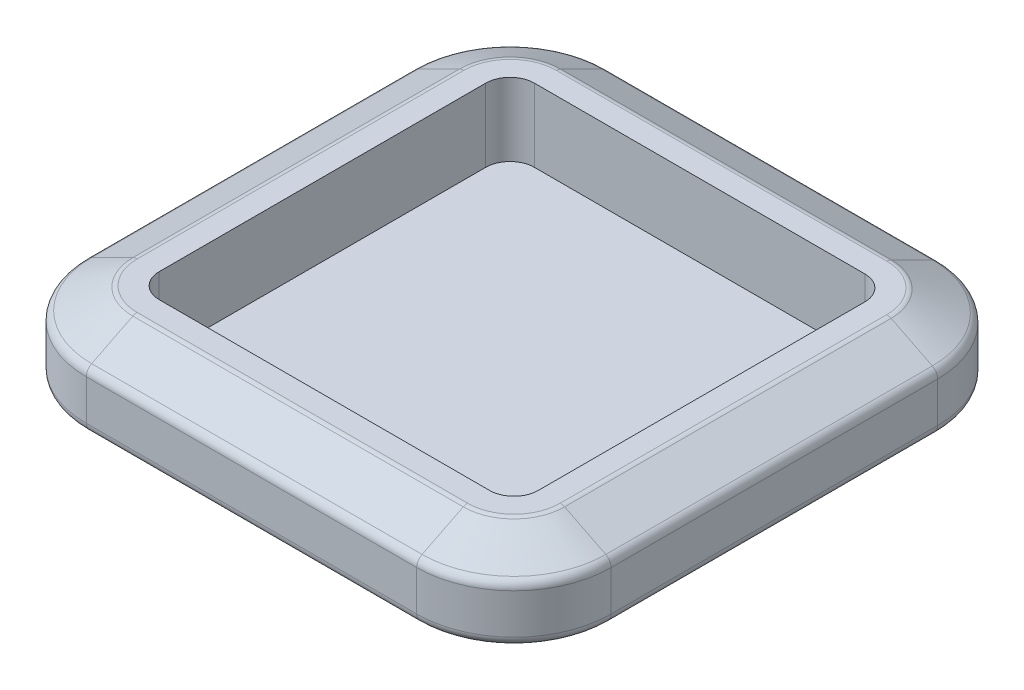
from build123d import *

# Parameters (mm, degrees)
SKETCH5_W           = 107.15
SKETCH5_H           = 18.5
BOSS_EXTRUDE1_DEPTH = 107.94999
SKETCH4_W           = 77.94999
SKETCH4_H           = 77.15084
CUT_EXTRUDE1_DEPTH  = 7.5
FILLET1_R           = 5
FILLET3_R           = 20
CHAMFER1_SIZE       = 10
CHAMFER1_SIZE2      = 5
CUT_EXTRUDE2_DEPTH  = 2
FILLET4_R           = 20
FILLET5_R           = 2
CUT_EXTRUDE3_START  = -7.5
CUT_EXTRUDE3_DEPTH  = 7.5


with BuildPart() as part:
    # Sketch5 → Boss-Extrude1 (new body)
    with BuildSketch(Plane.ZY.offset(-91.769)):
        with Locations((-38.2134, -9.25)):
            Rectangle(SKETCH5_W, SKETCH5_H)
    extrude(amount=BOSS_EXTRUDE1_DEPTH)

    # Sketch4 → Cut-Extrude1 (cut)
    with BuildSketch(Plane(origin=(0, 0, 0), x_dir=(1, 0, 0), z_dir=(0, 1, 0))):
        with Locations((37.794005, 38.21298)):
            Rectangle(SKETCH4_W, SKETCH4_H)
    extrude(amount=-CUT_EXTRUDE1_DEPTH, mode=Mode.SUBTRACT)

    # Fillet1
    fillet1_edges = [part.edges().sort_by_distance(p)[0] for p in [
        (76.769, -3.75, -76.7884),
        (76.769, -3.75, 0.36244),
        (-1.18099, -3.75, 0.36244),
        (-1.18099, -3.75, -76.7884),
    ]]
    fillet(fillet1_edges, radius=FILLET1_R)

    # Fillet3
    fillet3_edges = [part.edges().sort_by_distance(p)[0] for p in [
        (-16.18099, -9.25, -91.7884),
        (-16.18099, -9.25, 15.3616),
        (91.769, -9.25, -91.7884),
        (91.769, -9.25, 15.3616),
    ]]
    fillet(fillet3_edges, radius=FILLET3_R)

    # Chamfer1
    chamfer1_edges = [part.edges().sort_by_distance(p)[0] for p in [
        (37.794005, 0, -91.7884),
        (91.769, 0, -38.2134),
        (-16.18099, 0, -38.2134),
        (37.794005, 0, 15.3616),
        (-10.323125624, 0, -85.930535624),
        (-10.323125624, 0, 9.503735624),
        (85.911135624, 0, 9.503735624),
        (85.911135624, 0, -85.930535624),
    ]]
    chamfer1_side = [part.faces().sort_by_distance(p)[0] for p in [
        (37.794005, 0, 13.840602865),
    ]]
    chamfer(chamfer1_edges, length=CHAMFER1_SIZE, length2=CHAMFER1_SIZE2, reference=chamfer1_side[0])

    # Sketch6 → Cut-Extrude2 (cut)
    with BuildSketch(Plane.XZ.offset(18.5)):
        with BuildLine():
            Line((3.81901, -91.7884), (71.769, -91.7884))
            ThreePointArc((71.769, -91.7884), (85.911135624, -85.930535624), (91.769, -71.7884))
            Line((91.769, -71.7884), (91.769, -4.6384))
            ThreePointArc((91.769, -4.6384), (85.911135624, 9.503735624), (71.769, 15.3616))
            Line((71.769, 15.3616), (3.81901, 15.3616))
            ThreePointArc((3.81901, 15.3616), (-10.323125624, 9.503735624), (-16.18099, -4.6384))
            Line((-16.18099, -4.6384), (-16.18099, -71.7884))
            ThreePointArc((-16.18099, -71.7884), (-10.323125624, -85.930535624), (3.81901, -91.7884))
        make_face()
        with BuildLine():
            Line((3.81901, -79.7884), (71.769, -79.7884))
            ThreePointArc((71.769, -79.7884), (77.425854249, -77.445254249), (79.769, -71.7884))
            Line((79.769, -71.7884), (79.769, -4.6384))
            ThreePointArc((79.769, -4.6384), (77.425854249, 1.018454249), (71.769, 3.3616))
            Line((71.769, 3.3616), (3.81901, 3.3616))
            ThreePointArc((3.81901, 3.3616), (-1.837844249, 1.018454249), (-4.18099, -4.6384))
            Line((-4.18099, -4.6384), (-4.18099, -71.7884))
            ThreePointArc((-4.18099, -71.7884), (-1.837844249, -77.445254249), (3.81901, -79.7884))
        make_face(mode=Mode.SUBTRACT)
    extrude(amount=-CUT_EXTRUDE2_DEPTH, mode=Mode.SUBTRACT)

    # Fillet4
    # the kernel refuses this fillet: 20 mm, written as the material it adds along each edge
    with BuildSketch(Plane(origin=(71.769, -16.5, -4.6384), x_dir=(1, 0, 0), z_dir=(0, 0, -1))) as fillet4_piece_1:
        with BuildLine():
            CenterArc((16.717797887, 20), FILLET4_R, 244.158067237, 25.841932763)
            Line((8, 2), (8, 0))
            Line((8, 0), (16.717797887, 0))
        make_face()
    revolve(axis=Axis((71.769, -16.5, -4.6384), (0, -1, 0)), revolution_arc=90)
    with BuildSketch(Plane(origin=(79.769, -16.5, -71.7884), x_dir=(1, 0, 0), z_dir=(0, 0, 1)), Plane(origin=(-4.18099, -16.5, -4.6384), x_dir=(-1, 0, 0), z_dir=(0, 0, -1))) as fillet4_piece_2:
        with BuildLine():
            CenterArc((8.717797887, -20), FILLET4_R, 90, 25.841932763)
            Line((0, -2), (0, 0))
            Line((0, 0), (8.717797887, 0))
        make_face()
    extrude(amount=67.15)
    with BuildSketch(Plane(origin=(71.769, -16.5, -71.7884), x_dir=(0, 0, -1), z_dir=(-1, 0, 0))) as fillet4_piece_3:
        with BuildLine():
            CenterArc((16.717797887, 20), FILLET4_R, 244.158067237, 25.841932763)
            Line((8, 2), (8, 0))
            Line((8, 0), (16.717797887, 0))
        make_face()
    revolve(axis=Axis((71.769, -16.5, -71.7884), (0, -1, 0)), revolution_arc=90)
    with BuildSketch(Plane(origin=(3.81901, -16.5, -79.7884), x_dir=(0, 0, -1), z_dir=(1, 0, 0)), Plane(origin=(71.769, -16.5, 3.3616), x_dir=(0, 0, 1), z_dir=(-1, 0, 0))) as fillet4_piece_4:
        with BuildLine():
            CenterArc((8.717797887, -20), FILLET4_R, 90, 25.841932763)
            Line((0, -2), (0, 0))
            Line((0, 0), (8.717797887, 0))
        make_face()
    extrude(amount=67.94999)
    with BuildSketch(Plane(origin=(3.81901, -16.5, -71.7884), x_dir=(-1, 0, 0), z_dir=(0, 0, 1))) as fillet4_piece_5:
        with BuildLine():
            CenterArc((16.717797887, 20), FILLET4_R, 244.158067237, 25.841932763)
            Line((8, 2), (8, 0))
            Line((8, 0), (16.717797887, 0))
        make_face()
    revolve(axis=Axis((3.81901, -16.5, -71.7884), (0, -1, 0)), revolution_arc=90)
    with BuildSketch(Plane(origin=(3.81901, -16.5, -4.6384), x_dir=(0, 0, 1), z_dir=(1, 0, 0))) as fillet4_piece_6:
        with BuildLine():
            CenterArc((16.717797887, 20), FILLET4_R, 244.158067237, 25.841932763)
            Line((8, 2), (8, 0))
            Line((8, 0), (16.717797887, 0))
        make_face()
    revolve(axis=Axis((3.81901, -16.5, -4.6384), (0, -1, 0)), revolution_arc=90)

    # Fillet5
    fillet5_edges = [part.edges().sort_by_distance(p)[0] for p in [
        (-10.323125624, -16.5, -85.930535624),
        (-16.18099, -16.5, -38.2134),
        (-10.323125624, -16.5, 9.503735624),
        (37.794005, -16.5, 15.3616),
        (85.911135624, -16.5, 9.503735624),
        (91.769, -16.5, -38.2134),
        (85.911135624, -16.5, -85.930535624),
        (37.794005, -16.5, -91.7884),
        (-6.18099, 0, -38.2134),
        (-3.252057812, 0, -78.859467812),
        (-3.252057812, 0, 2.432667812),
        (37.794005, 0, -81.7884),
        (37.794005, 0, 5.3616),
        (78.840067812, 0, -78.859467812),
        (78.840067812, 0, 2.432667812),
        (81.769, 0, -38.2134),
        (91.769, -5, -38.2134),
        (85.911135624, -5, 9.503735624),
        (85.911135624, -5, -85.930535624),
        (37.794005, -5, 15.3616),
        (37.794005, -5, -91.7884),
        (-10.323125624, -5, 9.503735624),
        (-10.323125624, -5, -85.930535624),
        (-16.18099, -5, -38.2134),
    ]]
    fillet(fillet5_edges, radius=FILLET5_R)

    # Sketch8 → Cut-Extrude3 (cut)
    with BuildSketch(Plane(origin=(0, -7.5, 0), x_dir=(1, 0, 0), z_dir=(0, 1, 0)).offset(CUT_EXTRUDE3_START)):
        with BuildLine():
            Line((-1.18099, 71.7884), (-1.18099, 4.63756))
            ThreePointArc((-1.18099, 4.63756), (0.283476094, 1.102026094), (3.81901, -0.36244))
            Line((3.81901, -0.36244), (71.769, -0.36244))
            ThreePointArc((71.769, -0.36244), (75.304533906, 1.102026094), (76.769, 4.63756))
            Line((76.769, 4.63756), (76.769, 71.7884))
            ThreePointArc((76.769, 71.7884), (75.304533906, 75.323933906), (71.769, 76.7884))
            Line((71.769, 76.7884), (3.81901, 76.7884))
            ThreePointArc((3.81901, 76.7884), (0.283476094, 75.323933906), (-1.18099, 71.7884))
        make_face()
    extrude(amount=CUT_EXTRUDE3_DEPTH, mode=Mode.SUBTRACT)


solid = part.part
